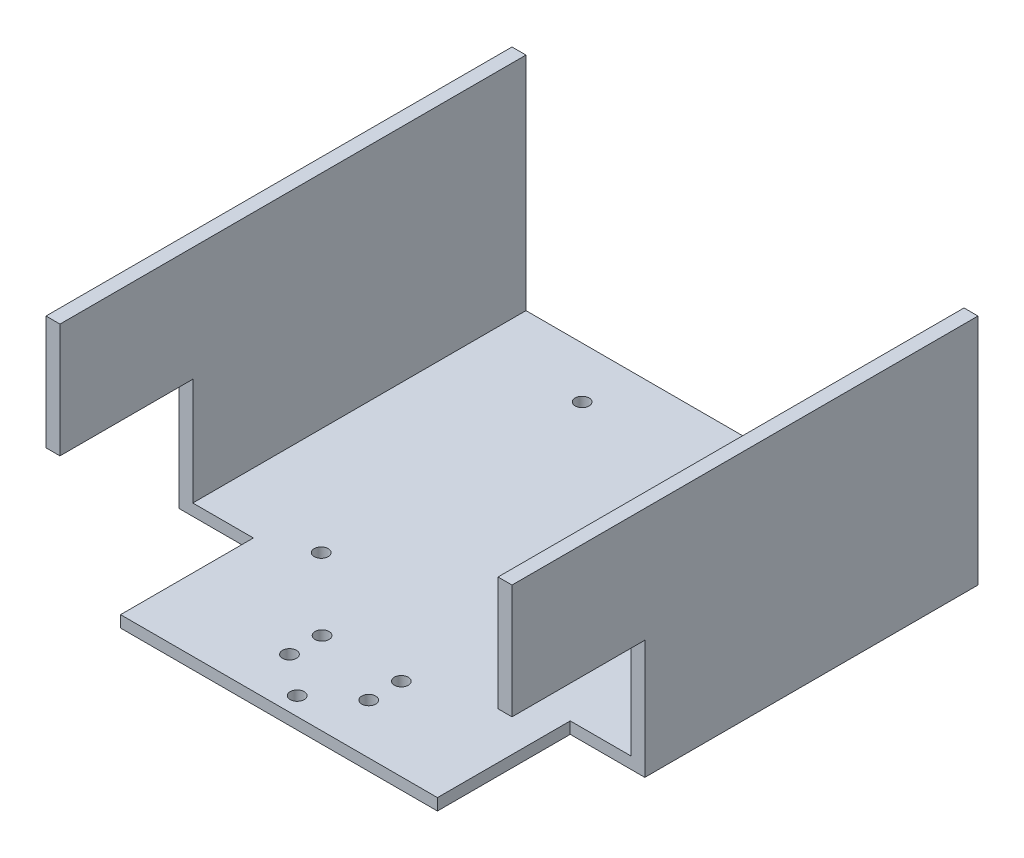
from build123d import *

# Parameters (mm, degrees)
SALIENTE_EXTRUIR1_DEPTH = 100
CROQUIS2_W              = 13
CROQUIS2_H              = 28.5
CORTAR_EXTRUIR2_DEPTH   = 10
CROQUIS3_R              = 1.5
CORTAR_EXTRUIR3_DEPTH   = 5
CROQUIS4_R              = 1.5
CORTAR_EXTRUIR4_DEPTH   = 10
CROQUIS5_R              = 1.5
CORTAR_EXTRUIR6_DEPTH   = 10
CROQUIS6_W              = 28.5
CROQUIS6_H              = 23
CORTAR_EXTRUIR8_DEPTH   = 151
CROQUIS7_W              = 3
CROQUIS7_H              = 2.5
CORTAR_EXTRUIR9_DEPTH   = 28.5


with BuildPart() as part:
    # Croquis1 → Saliente-Extruir1 (new body)
    with BuildSketch(Plane.XY):
        Polygon((50, 0), (-50, 0), (-50, 50), (-47, 50), (-47, 2.5), (47, 2.5), (47, 50), (50, 50), align=None)
    extrude(amount=-SALIENTE_EXTRUIR1_DEPTH)

    # Croquis2 → Cortar-Extruir2 (cut)
    with BuildSketch(Plane(origin=(0, 2.5, 0), x_dir=(1, 0, 0), z_dir=(0, 1, 0))):
        with Locations((-40.5, 14.25)):
            Rectangle(CROQUIS2_W, CROQUIS2_H)
        with Locations((40.5, 14.25)):
            Rectangle(CROQUIS2_W, CROQUIS2_H)
    extrude(amount=-CORTAR_EXTRUIR2_DEPTH, mode=Mode.SUBTRACT)

    # Croquis3 → Cortar-Extruir3 (cut)
    with BuildSketch(Plane(origin=(0, 2.5, 0), x_dir=(1, 0, 0), z_dir=(0, 1, 0))):
        with Locations((0, 3.9)):
            Circle(CROQUIS3_R)
    extrude(amount=-CORTAR_EXTRUIR3_DEPTH, mode=Mode.SUBTRACT)

    # Croquis4 → Cortar-Extruir4 (cut)
    with BuildSketch(Plane(origin=(0, 2.5, 0), x_dir=(1, 0, 0), z_dir=(0, 1, 0))):
        with Locations((-8.5, 17.75)):
            Circle(CROQUIS4_R)
        with Locations((-8.5, 10.75)):
            Circle(CROQUIS4_R)
        with Locations((8.5, 10.75)):
            Circle(CROQUIS4_R)
        with Locations((8.5, 17.75)):
            Circle(CROQUIS4_R)
    extrude(amount=-CORTAR_EXTRUIR4_DEPTH, mode=Mode.SUBTRACT)

    # Croquis5 → Cortar-Extruir6 (cut)
    with BuildSketch(Plane(origin=(0, 2.5, 0), x_dir=(1, 0, 0), z_dir=(0, 1, 0))):
        with Locations((-24, 89.05)):
            Circle(CROQUIS5_R)
        with Locations((-24, 33.05)):
            Circle(CROQUIS5_R)
        with Locations((24, 33.05)):
            Circle(CROQUIS5_R)
        with Locations((24, 89.05)):
            Circle(CROQUIS5_R)
    extrude(amount=-CORTAR_EXTRUIR6_DEPTH, mode=Mode.SUBTRACT)

    # Croquis6 → Cortar-Extruir8 (cut, through all)
    with BuildSketch(Plane.ZY.offset(50)):
        with Locations((-14.25, 14)):
            Rectangle(CROQUIS6_W, CROQUIS6_H)
    extrude(amount=-CORTAR_EXTRUIR8_DEPTH, mode=Mode.SUBTRACT)

    # Croquis7 → Cortar-Extruir9 (cut)
    with BuildSketch(Plane.XY):
        with Locations((-48.5, 1.25)):
            Rectangle(CROQUIS7_W, CROQUIS7_H)
        with Locations((48.5, 1.25)):
            Rectangle(CROQUIS7_W, CROQUIS7_H)
    extrude(amount=-CORTAR_EXTRUIR9_DEPTH, mode=Mode.SUBTRACT)


solid = part.part
